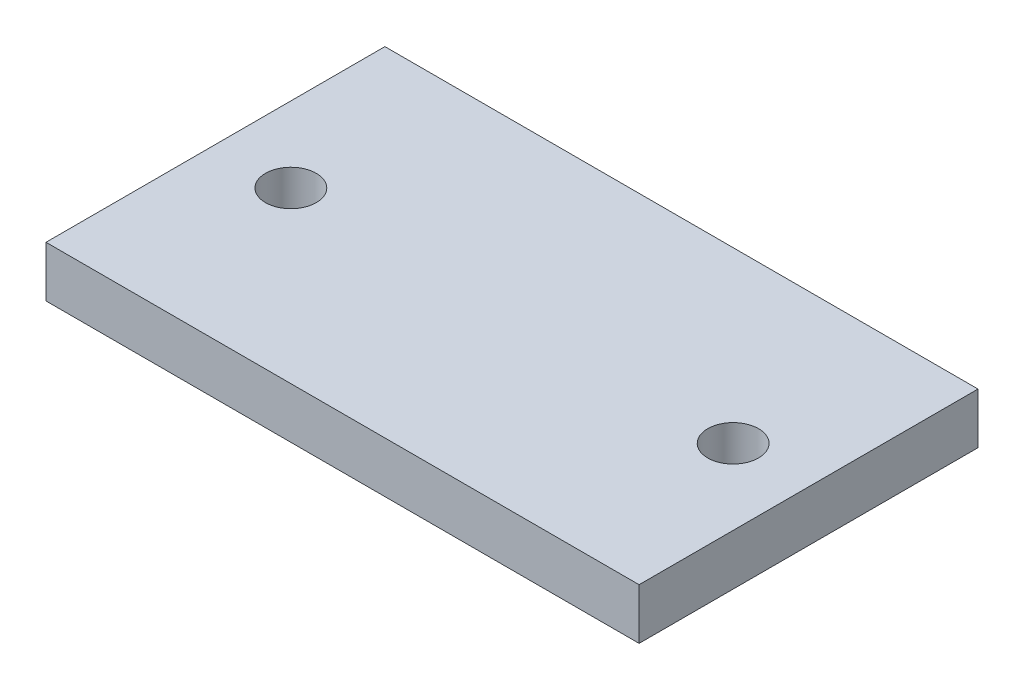
from build123d import *

# Parameters (mm, degrees)
SKETCH2_W           = 35
SKETCH2_H           = 20
SKETCH2_R           = 1.5
BOSS_EXTRUDE1_DEPTH = 3


with BuildPart() as part:
    # Sketch2 → Boss-Extrude1 (new body)
    with BuildSketch(Plane(origin=(0, 0, 0), x_dir=(1, 0, 0), z_dir=(0, 1, 0))):
        Rectangle(SKETCH2_W, SKETCH2_H)
        with Locations((-13.05, 0)):
            Circle(SKETCH2_R, mode=Mode.SUBTRACT)
        with Locations((13.05, 0)):
            Circle(SKETCH2_R, mode=Mode.SUBTRACT)
    extrude(amount=BOSS_EXTRUDE1_DEPTH)


solid = part.part
